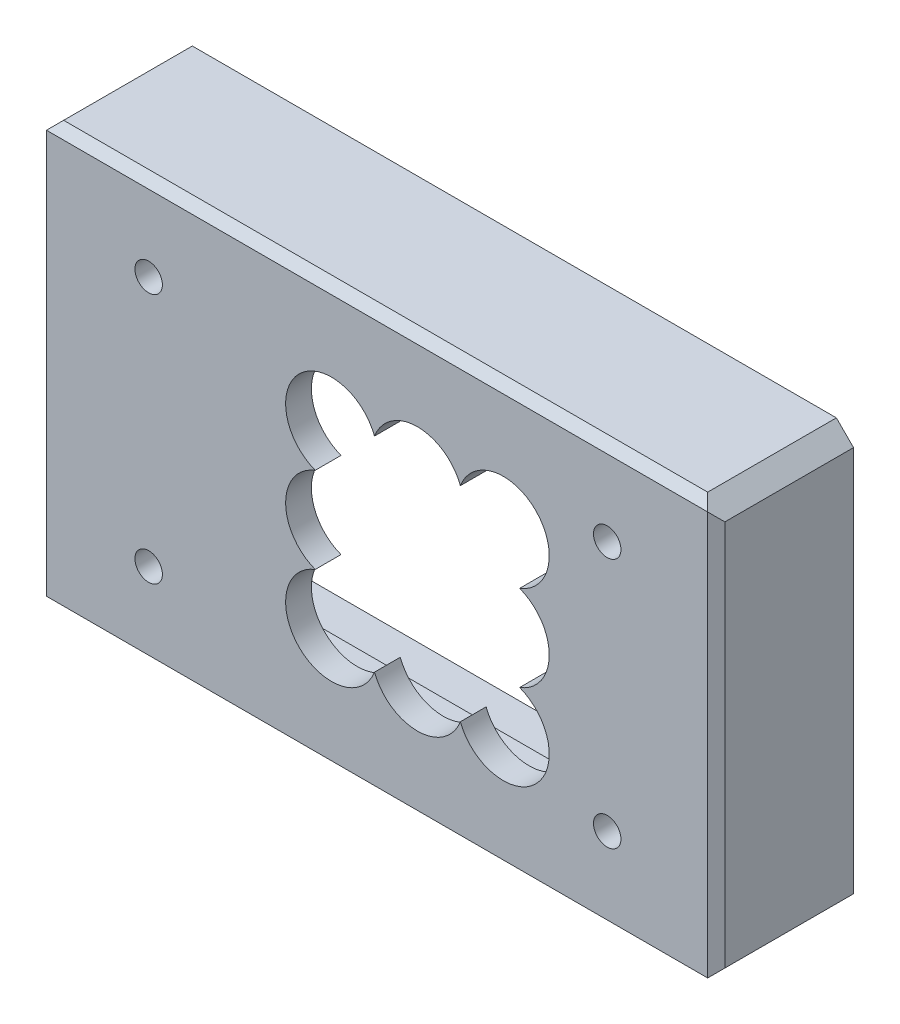
from build123d import *

# Parameters (mm, degrees)
BOSS_EXTRUDE1_START      = 4.485
SKETCH1_W                = 75
SKETCH1_H                = 45
SKETCH1_R                = 1.6
SKETCH1_W_2              = 47.4
SKETCH1_H_2              = 36.3
BOSS_EXTRUDE1_DEPTH      = 3
SKETCH1_4_W              = 75
SKETCH1_4_H              = 45
SKETCH1_4_R              = 1.6
SKETCH1_4_W_2            = 47.4
SKETCH1_4_H_2            = 36.3
BOSS_EXTRUDE2_DEPTH      = 4.485
BOSS_EXTRUDE3_DEPTH      = 8.5
BOSS_EXTRUDE3_DEPTH_BACK = 7.485
SKETCH2_W                = 79
SKETCH2_H                = 49
SKETCH2_W_2              = 75
SKETCH2_H_2              = 45
SKETCH4_W                = 8.5
SKETCH4_H                = 33
CUT_EXTRUDE1_DEPTH       = 52
CHAMFER1_SIZE            = 1
CHAMFER2_SIZE            = 2


with BuildPart() as part:
    # Sketch1 → Boss-Extrude1 (new body)
    # profile 1 of 2: a face of its own
    with BuildSketch(Plane.XY.offset(BOSS_EXTRUDE1_START)):
        with Locations((-52, -40.55)):
            Rectangle(SKETCH1_W, SKETCH1_H)
        with Locations(Location((-78.6, -55.1, 0), (0, 0, 270))):
            Circle(SKETCH1_R, mode=Mode.SUBTRACT)
        with Locations(Location((-78.6, -25.9, 0), (0, 0, 270))):
            Circle(SKETCH1_R, mode=Mode.SUBTRACT)
        with Locations(Location((-25.2, -25.9, 0), (0, 0, 270))):
            Circle(SKETCH1_R, mode=Mode.SUBTRACT)
        with Locations(Location((-25.2, -55.1, 0), (0, 0, 270))):
            Circle(SKETCH1_R, mode=Mode.SUBTRACT)
        with Locations((-51.9, -40.55)):
            Rectangle(SKETCH1_W_2, SKETCH1_H_2, mode=Mode.SUBTRACT)
    # profile 2 of 2: a face of its own
    with BuildSketch(Plane.XY.offset(BOSS_EXTRUDE1_START)):
        with Locations((-51.9, -40.55)):
            Rectangle(SKETCH1_W_2, SKETCH1_H_2)
        with BuildLine():
            ThreePointArc((-35.396713369, -35.7), (-32.895168364, -33.736438417), (-31.95, -30.7))
            ThreePointArc((-31.95, -30.7), (-36.332399876, -25.438227485), (-42.3, -28.796713369))
            ThreePointArc((-42.3, -28.796713369), (-47.3, -25.35), (-52.3, -28.796713369))
            ThreePointArc((-52.3, -28.796713369), (-58.267600124, -25.438227485), (-62.65, -30.7))
            ThreePointArc((-62.65, -30.7), (-61.704831636, -33.736438417), (-59.203286631, -35.7))
            ThreePointArc((-59.203286631, -35.7), (-61.704831636, -37.663561583), (-62.65, -40.7))
            ThreePointArc((-62.65, -40.7), (-61.704831636, -43.736438417), (-59.203286631, -45.7))
            ThreePointArc((-59.203286631, -45.7), (-61.704831636, -47.663561583), (-62.65, -50.7))
            ThreePointArc((-62.65, -50.7), (-58.267600124, -55.961772515), (-52.3, -52.603286631))
            ThreePointArc((-52.3, -52.603286631), (-47.3, -56.05), (-42.3, -52.603286631))
            ThreePointArc((-42.3, -52.603286631), (-36.332399876, -55.961772515), (-31.95, -50.7))
            ThreePointArc((-31.95, -50.7), (-32.895168364, -47.663561583), (-35.396713369, -45.7))
            ThreePointArc((-35.396713369, -45.7), (-32.895168364, -43.736438417), (-31.95, -40.7))
            ThreePointArc((-31.95, -40.7), (-32.895168364, -37.663561583), (-35.396713369, -35.7))
        make_face(mode=Mode.SUBTRACT)
    extrude(amount=BOSS_EXTRUDE1_DEPTH)

    # Sketch1<4> → Boss-Extrude2 (add)
    with BuildSketch(Plane.XY):
        with Locations((-52, -40.55)):
            Rectangle(SKETCH1_4_W, SKETCH1_4_H)
        with Locations((-78.6, -55.1)):
            Circle(SKETCH1_4_R, mode=Mode.SUBTRACT)
        with Locations((-78.6, -25.9)):
            Circle(SKETCH1_4_R, mode=Mode.SUBTRACT)
        with Locations((-25.2, -25.9)):
            Circle(SKETCH1_4_R, mode=Mode.SUBTRACT)
        with Locations((-25.2, -55.1)):
            Circle(SKETCH1_4_R, mode=Mode.SUBTRACT)
        with Locations((-51.9, -40.55)):
            Rectangle(SKETCH1_4_W_2, SKETCH1_4_H_2, mode=Mode.SUBTRACT)
    extrude(amount=BOSS_EXTRUDE2_DEPTH)

    # Sketch2 → Boss-Extrude3 (add, two sides: drawn at the far end of the back side and taken through both)
    with BuildSketch(Plane(origin=(0, 0, 0), x_dir=(-1, 0, 0), z_dir=(0, 0, -1)).offset(-BOSS_EXTRUDE3_DEPTH_BACK)):
        with Locations((52, -40.55)):
            Rectangle(SKETCH2_W, SKETCH2_H)
        with Locations((52, -40.55)):
            Rectangle(SKETCH2_W_2, SKETCH2_H_2, mode=Mode.SUBTRACT)
    extrude(amount=BOSS_EXTRUDE3_DEPTH + BOSS_EXTRUDE3_DEPTH_BACK)

    # Sketch4 → Cut-Extrude1 (cut)
    with BuildSketch(Plane(origin=(-89.5, 0, 0), x_dir=(0, 0, -1), z_dir=(1, 0, 0))):
        with Locations((4.25, -40.55)):
            Rectangle(SKETCH4_W, SKETCH4_H)
    extrude(amount=-CUT_EXTRUDE1_DEPTH, mode=Mode.SUBTRACT)

    # Chamfer1
    chamfer1_edges = [part.edges().sort_by_distance(p)[0] for p in [
        (-52, -65.05, 7.485),
        (-91.5, -40.55, 7.485),
        (-52, -16.05, 7.485),
        (-12.5, -40.55, 7.485),
    ]]
    chamfer(chamfer1_edges, length=CHAMFER1_SIZE)

    # Chamfer2
    chamfer2_edges = [part.edges().sort_by_distance(p)[0] for p in [
        (-12.5, -65.05, -1.0075),
        (-91.5, -65.05, -1.0075),
        (-12.5, -16.05, -1.0075),
        (-91.5, -16.05, -1.0075),
    ]]
    chamfer(chamfer2_edges, length=CHAMFER2_SIZE - 0.0001)  # a hair under: the kernel refuses the full size


solid = part.part
